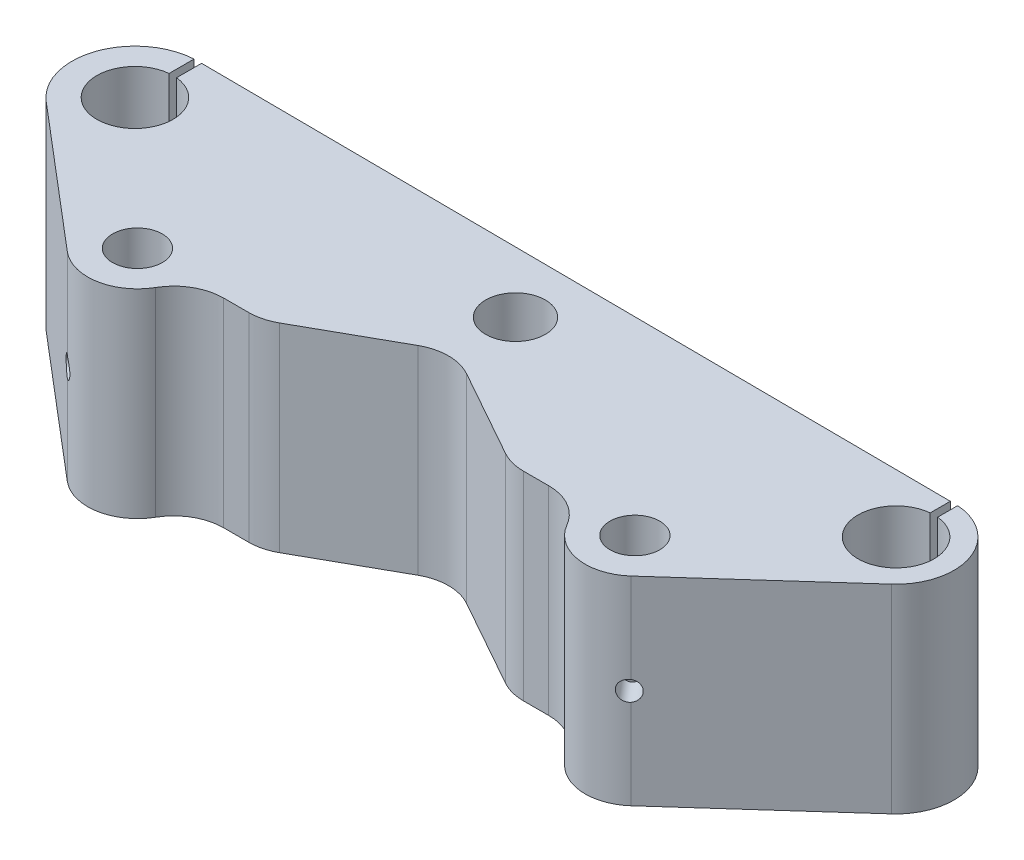
from build123d import *

# Parameters (mm, degrees)
SZKIC1_R                    = 7.65
SZKIC1_R_2                  = 6
SZKIC1_R_3                  = 5
DODANIE_WYCI_GNI_CIE1_DEPTH = 40
SZKIC2_R                    = 11
WYTNIJ_WYCI_GNI_CIE1_DEPTH  = 5
SZKIC3_R                    = 1.25
WYTNIJ_WYCI_GNI_CIE2_DEPTH  = 10
WYTNIJ_WYCI_GNI_CIE3_DEPTH  = 105.133195956
ZAOKR_GLENIE1_R             = 10
SZKIC5_R                    = 2
WYTNIJ_WYCI_GNI_CIE4_DEPTH  = 20
WYTNIJ_WYCI_GNI_CIE5_DEPTH  = 105.133196029


with BuildPart() as part:
    # Szkic1 → Dodanie-wyciągnięcie1 (new body)
    with BuildSketch(Plane(origin=(0, 0, 0), x_dir=(1, 0, 0), z_dir=(0, 1, 0))):
        with BuildLine():
            ThreePointArc((-76.5, 12.65), (-88.373421198, 4.363985457), (-84.69216402, -9.639032559))
            Line((-84.69216402, -9.639032559), (-56.476018988, -33.619788584))
            ThreePointArc((-56.476018988, -33.619788584), (-45.802392937, -35.076348106), (-40, -26))
            Line((-40, -26), (40, -26))
            ThreePointArc((40, -26), (45.925221554, -35.13215093), (56.679236123, -33.442298356))
            Line((56.679236123, -33.442298356), (84.281310083, -8.670277585))
            ThreePointArc((84.281310083, -8.670277585), (87.39314959, 4.130592211), (76.576123228, 11.649751296))
            Line((76.576123228, 11.649751296), (-76.5, 12.65))
        make_face()
        with Locations((-76.5, 0)):
            Circle(SZKIC1_R, mode=Mode.SUBTRACT)
        Circle(SZKIC1_R_2, mode=Mode.SUBTRACT)
        with Locations((76.5, 0)):
            Circle(SZKIC1_R, mode=Mode.SUBTRACT)
        with Locations((50, -26)):
            Circle(SZKIC1_R_3, mode=Mode.SUBTRACT)
        with Locations((-50, -26)):
            Circle(SZKIC1_R_3, mode=Mode.SUBTRACT)
    extrude(amount=DODANIE_WYCI_GNI_CIE1_DEPTH)

    # Szkic2 → Wytnij-wyciągnięcie1 (cut)
    with BuildSketch(Plane.XZ):
        Circle(SZKIC2_R)
    extrude(amount=-WYTNIJ_WYCI_GNI_CIE1_DEPTH, mode=Mode.SUBTRACT)

    # Szkic3 → Wytnij-wyciągnięcie2 (cut)
    with BuildSketch(Plane.XZ.offset(-5)):
        with Locations((-5.656854249, 5.656854249)):
            Circle(SZKIC3_R)
        with Locations((5.656854249, 5.656854249)):
            Circle(SZKIC3_R)
        with Locations((5.656854249, -5.656854249)):
            Circle(SZKIC3_R)
        with Locations((-5.656854249, -5.656854249)):
            Circle(SZKIC3_R)
    extrude(amount=-WYTNIJ_WYCI_GNI_CIE2_DEPTH, mode=Mode.SUBTRACT)

    # Szkic4 → Wytnij-wyciągnięcie3 (cut, through all)
    with BuildSketch(Plane(origin=(0, 40, 0), x_dir=(1, 0, 0), z_dir=(0, 1, 0))):
        Polygon((-25, -26), (0, -12), (25, -26), align=None)
    extrude(amount=-WYTNIJ_WYCI_GNI_CIE3_DEPTH, mode=Mode.SUBTRACT)

    # Zaokrąglenie1
    zaokr_glenie1_edges = [part.edges().sort_by_distance(p)[0] for p in [
        (40, 20, 26),
        (-40, 20, 26),
        (25, 20, 26),
        (0, 20, 12),
        (-25, 20, 26),
    ]]
    fillet(zaokr_glenie1_edges, radius=ZAOKR_GLENIE1_R)

    # Szkic5 → Wytnij-wyciągnięcie4 (cut)
    with BuildSketch(Plane(origin=(-40.2753628, 0, 47.388642659), x_dir=(0.761978858404398, 0, 0.647601898811863), z_dir=(-0.6476018988118629, 0, 0.7619788584043979))):
        with Locations((-21.261293551, 20)):
            Circle(SZKIC5_R)
    wytnij_wyci_gni_cie4 = extrude(amount=-WYTNIJ_WYCI_GNI_CIE4_DEPTH, mode=Mode.SUBTRACT)

    # Lustro1: Wytnij-wyciągnięcie4 across plane
    add(wytnij_wyci_gni_cie4.mirror(Plane(origin=(0, 0, 0), x_dir=(0, 0, 1), z_dir=(1, 0, 0))), mode=Mode.SUBTRACT)

    # Szkic6 → Wytnij-wyciągnięcie5 (cut, through all)
    with BuildSketch(Plane(origin=(0, 40, 0), x_dir=(1, 0, 0), z_dir=(0, 1, 0))):
        with BuildLine():
            ThreePointArc((-77.25, 7.613146524), (-76.5, 7.65), (-75.75, 7.613146524))
            Line((-75.75, 7.613146524), (-75.75, 12.645099258))
            Line((-75.75, 12.645099258), (-76.5, 12.65))
            ThreePointArc((-76.5, 12.65), (-76.875165026, 12.644435583), (-77.25, 12.627747226))
            Line((-77.25, 12.627747226), (-77.25, 7.613146524))
        make_face()
        with BuildLine():
            Line((76.576123228, 11.649751296), (75.75, 11.655149451))
            Line((75.75, 11.655149451), (75.75, 7.613146524))
            ThreePointArc((75.75, 7.613146524), (76.5, 7.65), (77.25, 7.613146524))
            Line((77.25, 7.613146524), (77.25, 11.625833303))
            ThreePointArc((77.25, 11.625833303), (76.913234697, 11.642668813), (76.576123228, 11.649751296))
        make_face()
    extrude(amount=-WYTNIJ_WYCI_GNI_CIE5_DEPTH, mode=Mode.SUBTRACT)


solid = part.part
